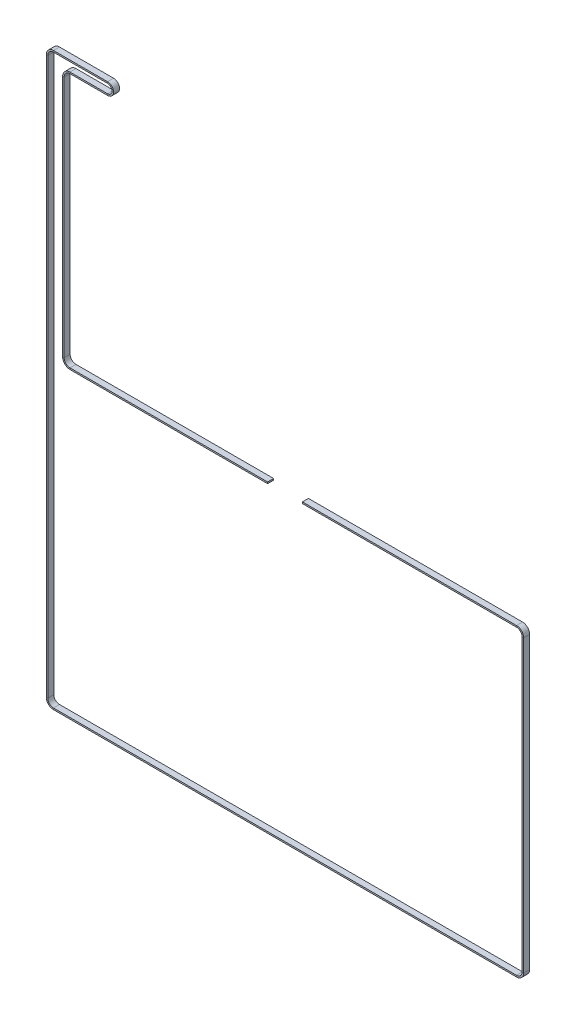
from build123d import *

# Parameters (mm, degrees)
SKETCH2_W = 6
SKETCH2_H = 1.5


with BuildPart() as part:
    # Sweep1: sweep along a path in Sketch1
    with BuildLine(Plane(origin=(0, -21, 4.45), x_dir=(1, 0, 0), z_dir=(0, 0, 1))) as sweep1_path:
        Line((241.85, -192.15), (455.5, -192.15))
        ThreePointArc((455.5, -192.15), (460.00780573, -194.01719427), (461.875, -198.525))
        Line((461.875, -198.525), (461.875, -488))
        ThreePointArc((461.875, -488), (460.00780573, -492.50780573), (455.5, -494.375))
        Line((455.5, -494.375), (-6.5, -494.375))
        ThreePointArc((-6.5, -494.375), (-11.00780573, -492.50780573), (-12.875, -488))
        Line((-12.875, -488), (-12.875, 67.325))
        ThreePointArc((-12.875, 67.325), (-11.00780573, 71.83280573), (-6.5, 73.7))
        Line((-6.5, 73.7), (47.5, 73.7))
        ThreePointArc((47.5, 73.7), (52.7, 68.5), (47.5, 63.3))
        Line((47.5, 63.3), (10, 63.3))
        ThreePointArc((10, 63.3), (5.333095244, 61.366904756), (3.4, 56.7))
        Line((3.4, 56.7), (3.4, -185.7))
        ThreePointArc((3.4, -185.7), (5.333095244, -190.366904756), (10, -192.3))
        Line((10, -192.3), (207.15, -192.3))
    # Sketch2 → Sweep1 (sweep)
    with BuildSketch(Plane(origin=(241.85, -213.15, 4.45), x_dir=(0, 0, 1), z_dir=(-1, 0, 0))):
        Rectangle(SKETCH2_W, SKETCH2_H)
    sweep(path=sweep1_path.line)


solid = part.part
